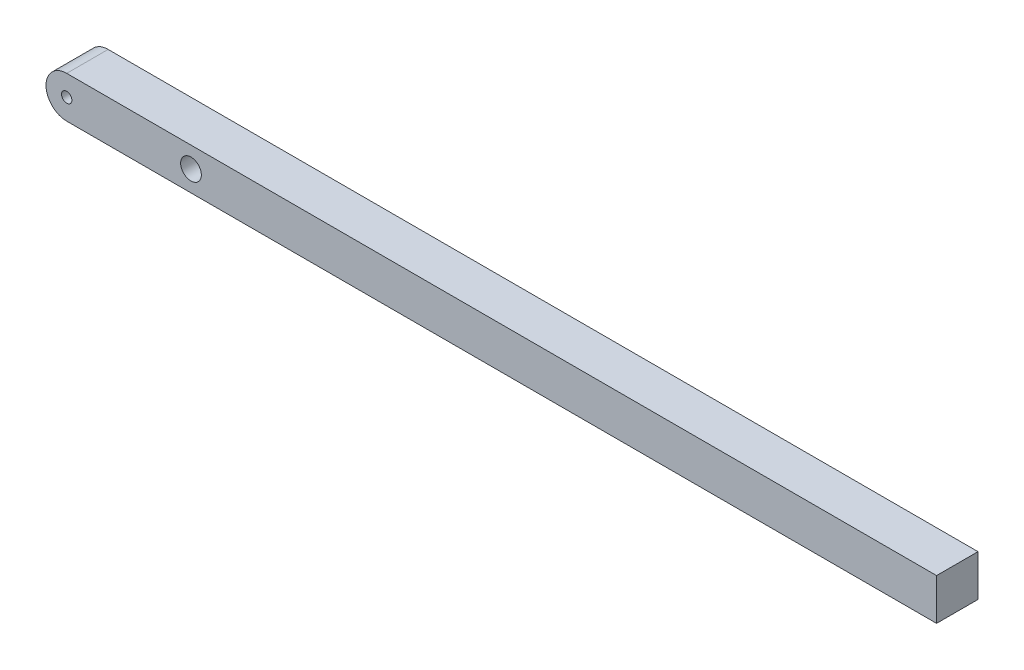
from build123d import *

# Parameters (mm, degrees)
BOSS_EXTRUDE1_DEPTH = 12.7
SKETCH1_10_R        = 3.175
SKETCH1_10_R_2      = 6.35
CUT_EXTRUDE3_DEPTH  = 12.7


with BuildPart() as part:
    # Sketch1 → Boss-Extrude1 (new, symmetric)
    with BuildSketch(Plane.XY):
        with BuildLine():
            Line((609.6, 25.4), (76.2, 25.4))
            ThreePointArc((76.2, 25.4), (63.5, 12.7), (76.2, 0))
            Line((76.2, 0), (609.6, 0))
            Line((609.6, 0), (609.6, 25.4))
        make_face()
    extrude(amount=BOSS_EXTRUDE1_DEPTH, both=True)

    # Sketch1<10> → Cut-Extrude3 (cut, symmetric)
    with BuildSketch(Plane.XY):
        with Locations((76.2, 12.7)):
            Circle(SKETCH1_10_R)
        with Locations((152.399994312, 12.7)):
            Circle(SKETCH1_10_R_2)
    extrude(amount=CUT_EXTRUDE3_DEPTH, both=True, mode=Mode.SUBTRACT)


solid = part.part
